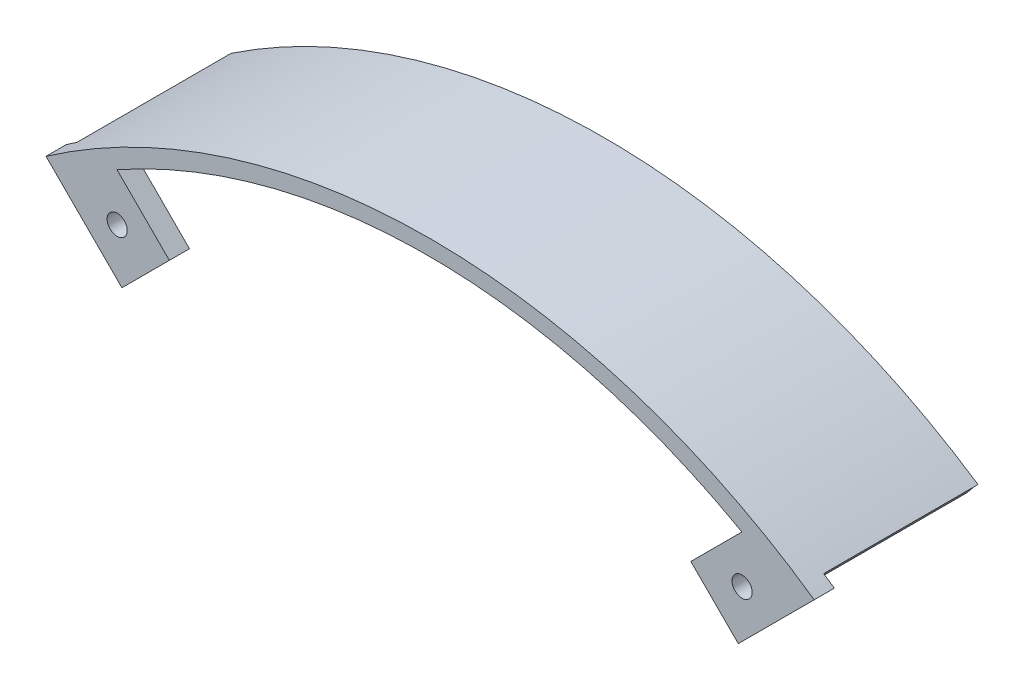
from build123d import *

# Parameters (mm, degrees)
CROQUIS1_R              = 100
SALIENTE_EXTRUIR1_DEPTH = 3
CROQUIS3_R              = 110
CORTAR_EXTRUIR1_DEPTH   = 3
REDONDEO1_R             = 10
CORTAR_EXTRUIR6_DEPTH   = 10
CROQUIS12_R             = 1.5
CORTAR_EXTRUIR7_DEPTH   = 142.453172607
CROQUIS9_R              = 1.5
CROQUIS9_W              = 4.5
CROQUIS9_H              = 8
CROQUIS9_W_2            = 8
CROQUIS9_H_2            = 4.5
CORTAR_EXTRUIR5_DEPTH   = 10
CORTAR_EXTRUIR9_DEPTH   = 142.453172607
SALIENTE_EXTRUIR3_START = -3
SALIENTE_EXTRUIR3_DEPTH = 3
SALIENTE_EXTRUIR4_DEPTH = 23
CORTAR_EXTRUIR10_DEPTH  = 119.122839627
CORTAR_EXTRUIR11_DEPTH  = 23
CORTAR_EXTRUIR14_DEPTH  = 23
CROQUIS21_R             = 1.5
CORTAR_EXTRUIR15_DEPTH  = 118.49895847


with BuildPart() as part:
    # Croquis1 → Saliente-Extruir1 (new body)
    with BuildSketch(Plane.XY):
        Circle(CROQUIS1_R)
    extrude(amount=SALIENTE_EXTRUIR1_DEPTH)

    # Croquis3 → Cortar-Extruir1 (cut)
    with BuildSketch(Plane.XY.offset(3)):
        with Locations((190, 0)):
            Circle(CROQUIS3_R)
    extrude(amount=-CORTAR_EXTRUIR1_DEPTH, mode=Mode.SUBTRACT)

    # Redondeo1
    redondeo1_edges = [part.edges().sort_by_distance(p)[0] for p in [
        (89.473684211, -44.659375654, 1.5),
        (89.473684211, 44.659375654, 1.5),
    ]]
    fillet(redondeo1_edges, radius=REDONDEO1_R)

    # Croquis5 → Cortar-Extruir6 (cut)
    with BuildSketch(Plane.XY.offset(3)):
        Polygon((-58.336309448, -83.085046789), (-83.085046789, -58.336309448), (-65.40737726, -40.658639918), (-40.658639918, -65.40737726), align=None)
        Polygon((-83.085046789, 58.336309448), (-58.336309448, 83.085046789), (-40.658639918, 65.40737726), (-65.40737726, 40.658639918), align=None)
        Polygon((58.336309448, -83.085046789), (83.085046789, -58.336309448), (65.40737726, -40.658639918), (40.658639918, -65.40737726), align=None)
        Polygon((58.336309448, 83.085046789), (83.085046789, 58.336309448), (65.40737726, 40.658639918), (40.658639918, 65.40737726), align=None)
    extrude(amount=-CORTAR_EXTRUIR6_DEPTH, mode=Mode.SUBTRACT)

    # Croquis12 → Cortar-Extruir7 (cut, through all)
    with BuildSketch(Plane.XY.offset(3)):
        with Locations((-63.604254904, -36.804908024)):
            Circle(CROQUIS12_R)
        with Locations((-36.804907897, -63.604255031)):
            Circle(CROQUIS12_R)
        with Locations((-47.666068056, -20.866721176)):
            Circle(CROQUIS12_R)
        with Locations((-20.866721049, -47.666068183)):
            Circle(CROQUIS12_R)
        with Locations((47.666068183, 20.866721049)):
            Circle(CROQUIS12_R)
        with Locations((20.866721176, 47.666068056)):
            Circle(CROQUIS12_R)
        with Locations((63.604255031, 36.804907897)):
            Circle(CROQUIS12_R)
        with Locations((36.804908024, 63.604254904)):
            Circle(CROQUIS12_R)
        with Locations((20.866721325, -47.666067908)):
            Circle(CROQUIS12_R)
        with Locations((47.666068332, -20.866720901)):
            Circle(CROQUIS12_R)
        with Locations((63.60425518, -36.804907749)):
            Circle(CROQUIS12_R)
        with Locations((36.804908173, -63.604254756)):
            Circle(CROQUIS12_R)
        with Locations((-63.604254756, 36.804908173)):
            Circle(CROQUIS12_R)
        with Locations((-36.804907749, 63.60425518)):
            Circle(CROQUIS12_R)
        with Locations((-20.866720901, 47.666068332)):
            Circle(CROQUIS12_R)
        with Locations((-47.666067908, 20.866721325)):
            Circle(CROQUIS12_R)
    extrude(amount=-CORTAR_EXTRUIR7_DEPTH, mode=Mode.SUBTRACT)

    # Croquis9 → Cortar-Extruir5 (cut)
    with BuildSketch(Plane.XY.offset(3)):
        with Locations((71.9, -4)):
            Circle(CROQUIS9_R)
        with Locations((35.959143483, 4)):
            Circle(CROQUIS9_R)
        with Locations((71.959143483, 4)):
            Circle(CROQUIS9_R)
        with Locations((35.9, -4)):
            Circle(CROQUIS9_R)
        with Locations((-91.190074744, 4)):
            Circle(CROQUIS9_R)
        with Locations((-91.190074744, -4)):
            Circle(CROQUIS9_R)
        with Locations((-55.190074744, 4)):
            Circle(CROQUIS9_R)
        with Locations((-55.190074744, -4)):
            Circle(CROQUIS9_R)
        with Locations((-4, 85)):
            Circle(CROQUIS9_R)
        with Locations((4, 85)):
            Circle(CROQUIS9_R)
        with Locations((-4, 49)):
            Circle(CROQUIS9_R)
        with Locations((4, 49)):
            Circle(CROQUIS9_R)
        with Locations((-4, -49)):
            Circle(CROQUIS9_R)
        with Locations((4, -49)):
            Circle(CROQUIS9_R)
        with Locations((4, -85)):
            Circle(CROQUIS9_R)
        with Locations((-4, -85)):
            Circle(CROQUIS9_R)
        with Locations((41.209143483, 0)):
            Rectangle(CROQUIS9_W, CROQUIS9_H)
        with Locations((0, -54.25)):
            Rectangle(CROQUIS9_W_2, CROQUIS9_H_2)
        with Locations((-60.440074744, 0)):
            Rectangle(CROQUIS9_W, CROQUIS9_H)
        with Locations((0, 54.25)):
            Rectangle(CROQUIS9_W_2, CROQUIS9_H_2)
    extrude(amount=-CORTAR_EXTRUIR5_DEPTH, mode=Mode.SUBTRACT)

    # Croquis13 → Cortar-Extruir9 (cut, through all)
    with BuildSketch(Plane.XY.offset(3)):
        with BuildLine():
            Line((-53.709599002, 78.458336343), (-40.658639918, 65.40737726))
            Line((-40.658639918, 65.40737726), (-65.40737726, 40.658639918))
            Line((-65.40737726, 40.658639918), (-81.993870249, 57.245132907))
            ThreePointArc((-81.993870249, 57.245132907), (-100, 0), (-81.993870249, -57.245132907))
            Line((-81.993870249, -57.245132907), (-65.40737726, -40.658639918))
            Line((-65.40737726, -40.658639918), (-40.658639918, -65.40737726))
            Line((-40.658639918, -65.40737726), (-57.245132907, -81.993870249))
            ThreePointArc((-57.245132907, -81.993870249), (0, -100), (57.245132907, -81.993870249))
            Line((57.245132907, -81.993870249), (40.658639918, -65.40737726))
            Line((40.658639918, -65.40737726), (65.40737726, -40.658639918))
            Line((65.40737726, -40.658639918), (81.993870249, -57.245132907))
            ThreePointArc((81.993870249, -57.245132907), (90.456214357, -50.775094972), (87.719298246, -40.480341508))
            ThreePointArc((87.719298246, -40.480341508), (80, 0), (87.719298246, 40.480341508))
            ThreePointArc((87.719298246, 40.480341508), (93.238979947, 51.725451206), (81.993870249, 57.245132907))
            Line((81.993870249, 57.245132907), (65.40737726, 40.658639918))
            Line((65.40737726, 40.658639918), (40.658639918, 65.40737726))
            Line((40.658639918, 65.40737726), (53.489520931, 78.238258273))
            ThreePointArc((53.489520931, 78.238258273), (-0.076031766, 94.913097691), (-53.709599002, 78.458336343))
        make_face()
    extrude(amount=-CORTAR_EXTRUIR9_DEPTH, mode=Mode.SUBTRACT)

    # Croquis14 → Saliente-Extruir3 (add)
    with BuildSketch(Plane(origin=(0, 0, 0), x_dir=(-1, 0, 0), z_dir=(0, 0, -1)).offset(SALIENTE_EXTRUIR3_START)):
        with BuildLine():
            Line((45.931424408, 70.68016175), (38.860356597, 77.751229562))
            Line((38.860356597, 77.751229562), (44.891480587, 83.782353552))
            ThreePointArc((44.891480587, 83.782353552), (49.372752226, 81.239949702), (53.709599002, 78.458336343))
            Line((53.709599002, 78.458336343), (45.931424408, 70.68016175))
        make_face()
        with BuildLine():
            Line((-45.931424408, 70.68016175), (-38.860356597, 77.751229562))
            Line((-38.860356597, 77.751229562), (-44.702591339, 83.593464304))
            ThreePointArc((-44.702591339, 83.593464304), (-49.168617514, 81.034921456), (-53.489520931, 78.238258273))
            Line((-53.489520931, 78.238258273), (-45.931424408, 70.68016175))
        make_face()
    extrude(amount=SALIENTE_EXTRUIR3_DEPTH)

    # Croquis15 → Saliente-Extruir4 (add)
    with BuildSketch(Plane.XY.offset(3)):
        with BuildLine():
            Line((57.245132907, 81.993870249), (45.931424408, 70.68016175))
            Line((45.931424408, 70.68016175), (38.860356597, 77.751229562))
            Line((38.860356597, 77.751229562), (44.702591339, 83.593464304))
            ThreePointArc((44.702591339, 83.593464304), (-0.070778824, 94.913086762), (-44.891480587, 83.782353552))
            Line((-44.891480587, 83.782353552), (-38.860356597, 77.751229562))
            Line((-38.860356597, 77.751229562), (-45.931424408, 70.68016175))
            Line((-45.931424408, 70.68016175), (-57.245132907, 81.993870249))
            ThreePointArc((-57.245132907, 81.993870249), (0, 100), (57.245132907, 81.993870249))
        make_face()
    extrude(amount=SALIENTE_EXTRUIR4_DEPTH)

    # Croquis16 → Cortar-Extruir10 (cut, through all)
    with BuildSketch(Plane(origin=(0, 0, 0), x_dir=(-1, 0, 0), z_dir=(0, 0, -1))):
        with BuildLine():
            Line((-44.702591339, 83.593464304), (-46.470358292, 85.361231257))
            ThreePointArc((-46.470358292, 85.361231257), (0.069710797, 97.650396076), (46.65924754, 85.550120505))
            Line((46.65924754, 85.550120505), (44.891480587, 83.782353552))
            ThreePointArc((44.891480587, 83.782353552), (0.070778824, 94.913086762), (-44.702591339, 83.593464304))
        make_face()
    extrude(amount=-CORTAR_EXTRUIR10_DEPTH, mode=Mode.SUBTRACT)

    # Croquis17 → Cortar-Extruir11 (cut)
    with BuildSketch(Plane(origin=(0, 0, 0), x_dir=(-1, 0, 0), z_dir=(0, 0, -1))):
        Polygon((-45.931424408, 70.68016175), (-55.477365954, 80.226103296), (-46.470358292, 85.361231257), (-38.860356597, 77.751229562), align=None)
        Polygon((46.65924754, 85.550120505), (38.860356597, 77.751229562), (45.931424408, 70.68016175), (55.477365954, 80.226103296), align=None)
    extrude(amount=-CORTAR_EXTRUIR11_DEPTH, mode=Mode.SUBTRACT)

    # Croquis20 → Cortar-Extruir14 (cut)
    with BuildSketch(Plane(origin=(0, 0, 0), x_dir=(-1, 0, 0), z_dir=(0, 0, -1))):
        with BuildLine():
            Line((57.245132907, 81.993870249), (55.477365954, 80.226103296))
            ThreePointArc((55.477365954, 80.226103296), (54.40334919, 80.386124061), (53.761558746, 81.262037118))
            Line((53.761558746, 81.262037118), (55.557141199, 83.059809274))
            ThreePointArc((55.557141199, 83.059809274), (56.621900253, 82.876434291), (57.245132907, 81.993870249))
        make_face()
        with BuildLine():
            Line((-57.245132907, 81.993870249), (-55.477365954, 80.226103296))
            ThreePointArc((-55.477365954, 80.226103296), (-54.519142467, 80.346961085), (-53.927035504, 81.109986773))
            Line((-53.927035504, 81.109986773), (-55.553473978, 83.059809274))
            ThreePointArc((-55.553473978, 83.059809274), (-56.620066643, 82.877193797), (-57.245132907, 81.993870249))
        make_face()
    extrude(amount=-CORTAR_EXTRUIR14_DEPTH, mode=Mode.SUBTRACT)

    # Croquis21 → Cortar-Extruir15 (cut, through all)
    with BuildSketch(Plane(origin=(0, 0, 23), x_dir=(-1, 0, 0), z_dir=(0, 0, -1))):
        with Locations((-46.499589386, 78.31939454)):
            Circle(CROQUIS21_R)
        with Locations((46.63853119, 78.458336343)):
            Circle(CROQUIS21_R)
    extrude(amount=-CORTAR_EXTRUIR15_DEPTH, mode=Mode.SUBTRACT)


solid = part.part
